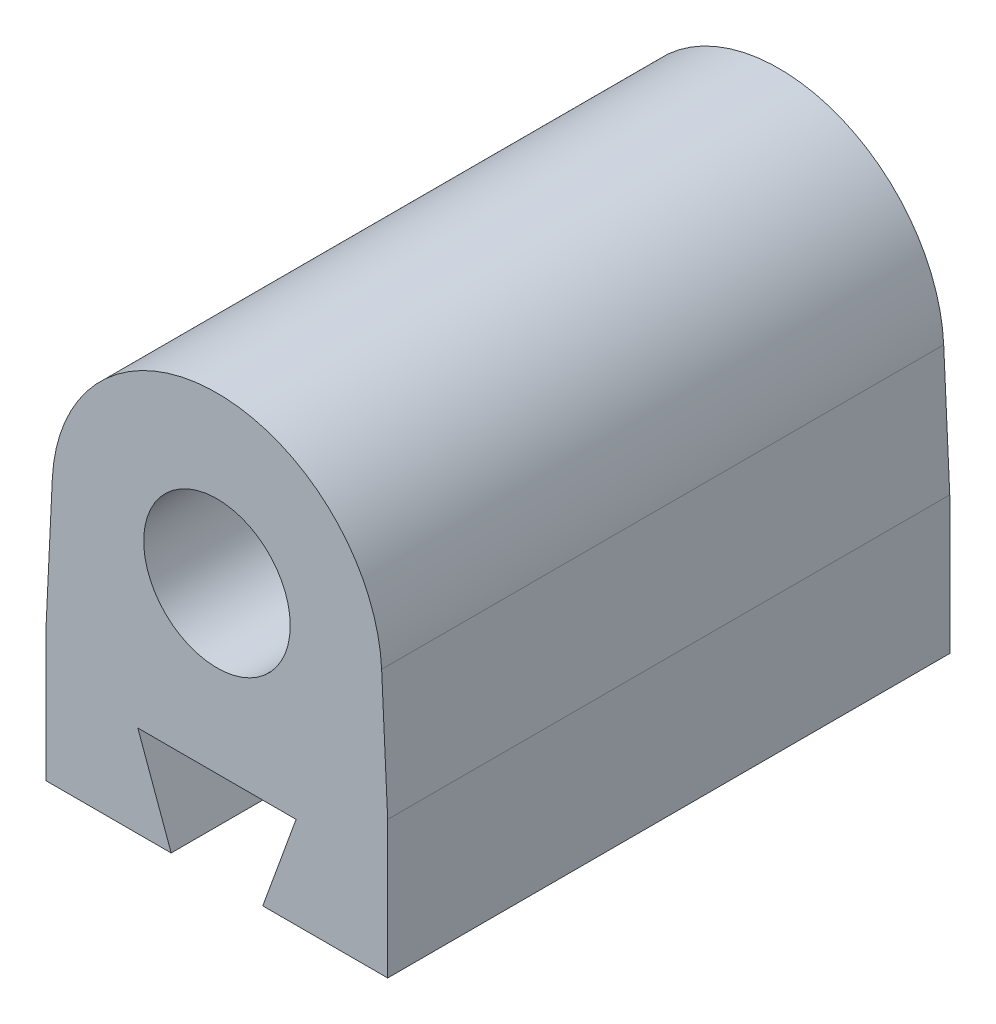
from build123d import *

# Parameters (mm, degrees)
SKETCH1_R           = 8
BOSS_EXTRUDE1_DEPTH = 61.37


with BuildPart() as part:
    # Sketch1 → Boss-Extrude1 (new body)
    with BuildSketch(Plane.XY):
        with BuildLine():
            Line((-37.279404685, 0), (-23.639702343, 0))
            Line((-23.639702343, 0), (-27.279404685, 10))
            Line((-27.279404685, 10), (-10, 10))
            Line((-10, 10), (-13.639702343, 0))
            Line((-13.639702343, 0), (0, 0))
            Line((0, 0), (0, 15))
            Line((0, 15), (-0.660091779, 28.856506857))
            ThreePointArc((-0.660091779, 28.856506857), (-18.639702343, 46), (-36.619312906, 28.856506857))
            Line((-36.619312906, 28.856506857), (-37.279404685, 15))
            Line((-37.279404685, 15), (-37.279404685, 0))
        make_face()
        with Locations((-18.639702343, 28)):
            Circle(SKETCH1_R, mode=Mode.SUBTRACT)
    extrude(amount=BOSS_EXTRUDE1_DEPTH)


solid = part.part
